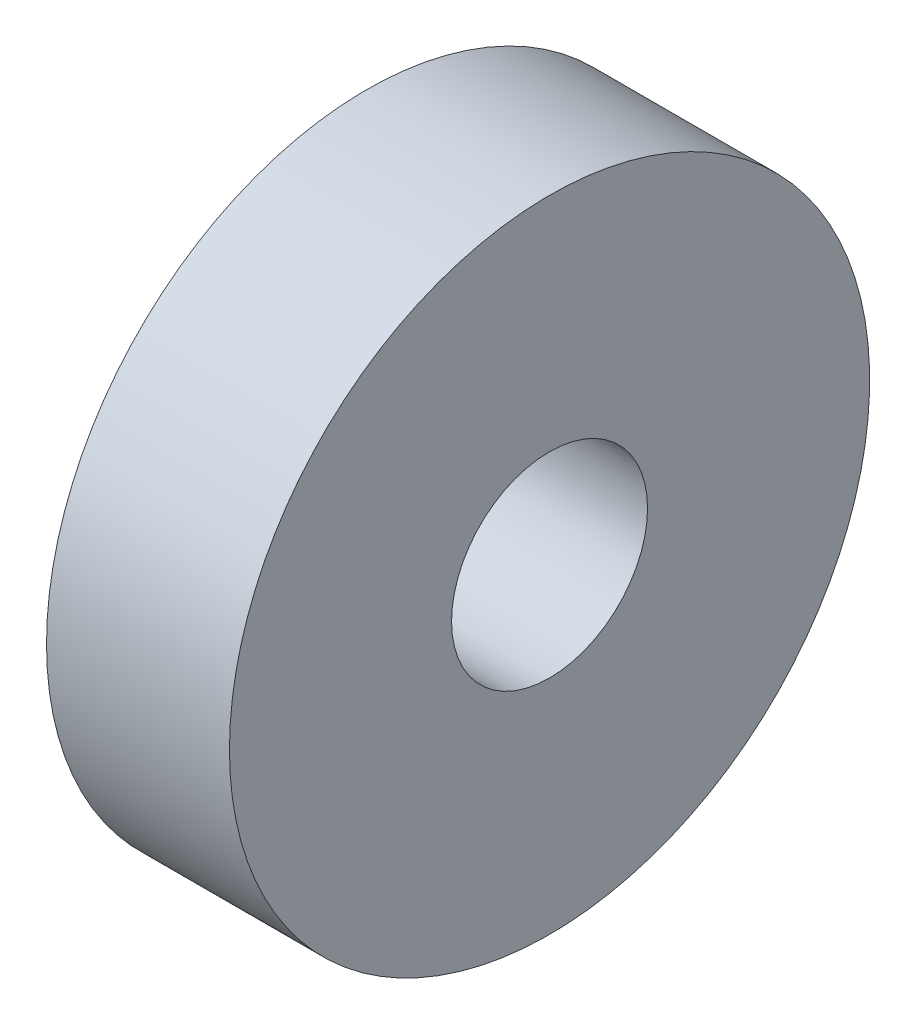
from build123d import *

# Parameters (mm, degrees)
SKETCH3_R           = 165.1
BOSS_EXTRUDE3_DEPTH = 88.9
CAVITY1_OUTLINE_R   = 152.4
CAVITY1_OUTLINE_R_2 = 50.8
CAVITY1_DEPTH       = 82.55
CAVITY1_2_OUTLINE_R = 50.8
CAVITY1_2_DEPTH     = 19.05
SKETCH4_R           = 47.625
CUT_EXTRUDE1_DEPTH  = 244.710981492
SKETCH5_R           = 165.1
SKETCH5_R_2         = 155.575
CUT_EXTRUDE2_DEPTH  = 250.838407776


# Read off the part's stored shape, not the designer's step: Cavity1
with BuildPart() as part:
    # Sketch3 → Boss-Extrude3 (new body)
    with BuildSketch(Plane(origin=(0, 0, 0), x_dir=(0, 0, -1), z_dir=(1, 0, 0))):
        Circle(SKETCH3_R)
    extrude(amount=BOSS_EXTRUDE3_DEPTH)

    # Cavity1 outline → Cavity1 (cut)
    with BuildSketch(Plane.YZ):
        Circle(CAVITY1_OUTLINE_R)
        with BuildLine():
            ThreePointArc((-80.874334871, -117.782034216), (-101.027881362, -101.027881362), (-117.782034216, -80.874334871))
            Line((-117.782034216, -80.874334871), (-94.778746917, -76.818234675))
            Line((-94.778746917, -76.818234675), (-76.818234675, -94.778746917))
            Line((-76.818234675, -94.778746917), (-80.874334871, -117.782034216))
        make_face(mode=Mode.SUBTRACT)
        with BuildLine():
            ThreePointArc((-29.644909568, -139.765678769), (-54.675895399, -131.999288208), (-77.867142651, -119.791375818))
            Line((-77.867142651, -119.791375818), (-58.16707868, -107.241050926))
            Line((-58.16707868, -107.241050926), (-34.700538554, -116.961210108))
            Line((-34.700538554, -116.961210108), (-29.644909568, -139.765678769))
        make_face(mode=Mode.SUBTRACT)
        Polygon((-27.135112552, -136.417422958), (-32.318310369, -113.037528491), (-19.758046068, -99.330405283), (-13.399363914, -116.800740918), align=None, mode=Mode.SUBTRACT)
        Polygon((-77.274262751, -115.64910694), (-73.115814864, -92.065377038), (-56.266154796, -84.208251511), (-57.077106506, -102.782099343), align=None, mode=Mode.SUBTRACT)
        Polygon((-54.018741267, -105.522753308), (-53.132050408, -85.214193765), (-33.571867462, -72.752982915), (-27.705232431, -75.18302271), (-22.685501123, -97.825567407), (-36.418836172, -112.812872694), align=None, mode=Mode.SUBTRACT)
        Polygon((-19.446749666, -97.765412591), (-22.958048426, -81.926967419), (-14.449239382, -72.641231776), (-10.141622048, -84.476313131), align=None, mode=Mode.SUBTRACT)
        with BuildLine():
            ThreePointArc((-119.791375818, -77.867142651), (-131.999288208, -54.675895399), (-139.765678769, -29.644909568))
            Line((-139.765678769, -29.644909568), (-116.961210108, -34.700538554))
            Line((-116.961210108, -34.700538554), (-107.241050926, -58.16707868))
            Line((-107.241050926, -58.16707868), (-119.791375818, -77.867142651))
        make_face(mode=Mode.SUBTRACT)
        Polygon((-115.64910694, -77.274262751), (-102.782099343, -57.077106506), (-84.208251511, -56.266154796), (-92.065377038, -73.115814864), align=None, mode=Mode.SUBTRACT)
        Polygon((-112.812872694, -36.418836172), (-97.825567407, -22.685501123), (-75.18302271, -27.705232431), (-72.752982915, -33.571867462), (-85.214193765, -53.132050408), (-105.522753308, -54.018741267), align=None, mode=Mode.SUBTRACT)
        Polygon((-136.417422958, -27.135112552), (-116.800740918, -13.399363914), (-99.330405283, -19.758046068), (-113.037528491, -32.318310369), align=None, mode=Mode.SUBTRACT)
        Polygon((-97.765412591, -19.446749666), (-84.476313131, -10.141622048), (-72.641231776, -14.449239382), (-81.926967419, -22.958048426), align=None, mode=Mode.SUBTRACT)
        Polygon((-90.288618857, -76.818234675), (-81.697674049, -58.39489408), (-58.857722433, -54.367594373), (-54.367594373, -58.857722433), (-58.39489408, -81.697674049), (-76.818234675, -90.288618857), align=None, mode=Mode.SUBTRACT)
        Polygon((-41.147952433, -61.582262732), (-41.6973225, -74.164905949), (-55.379657648, -82.88151477), (-52.562564142, -66.904983587), align=None, mode=Mode.SUBTRACT)
        Polygon((-82.88151477, -55.379657648), (-74.164905949, -41.6973225), (-61.582262732, -41.147952433), (-66.904983587, -52.562564142), align=None, mode=Mode.SUBTRACT)
        with BuildLine():
            Line((-58.006231883, -40.991819554), (-48.83234649, -40.591279067))
            ThreePointArc((-48.83234649, -40.591279067), (-44.901280605, -44.901280605), (-40.591279067, -48.83234649))
            Line((-40.591279067, -48.83234649), (-40.991819554, -58.006231883))
            Line((-40.991819554, -58.006231883), (-47.632402282, -61.102786463))
            Line((-47.632402282, -61.102786463), (-61.102786463, -47.632402282))
            Line((-61.102786463, -47.632402282), (-58.006231883, -40.991819554))
        make_face(mode=Mode.SUBTRACT)
        with BuildLine():
            Line((-37.903880189, -60.069527002), (-29.581595449, -56.188781894))
            ThreePointArc((-29.581595449, -56.188781894), (-24.300397955, -58.666350314), (-18.814121964, -60.648815444))
            Line((-18.814121964, -60.648815444), (-15.673479171, -69.2776606))
            Line((-15.673479171, -69.2776606), (-20.623577502, -74.67974499))
            Line((-20.623577502, -74.67974499), (-38.223482596, -67.389625603))
            Line((-38.223482596, -67.389625603), (-37.903880189, -60.069527002))
        make_face(mode=Mode.SUBTRACT)
        with BuildLine():
            Line((-69.2776606, -15.673479171), (-60.648815444, -18.814121964))
            ThreePointArc((-60.648815444, -18.814121964), (-58.666350314, -24.300397955), (-56.188781894, -29.581595449))
            Line((-56.188781894, -29.581595449), (-60.069527002, -37.903880189))
            Line((-60.069527002, -37.903880189), (-67.389625603, -38.223482596))
            Line((-67.389625603, -38.223482596), (-74.67974499, -20.623577502))
            Line((-74.67974499, -20.623577502), (-69.2776606, -15.673479171))
        make_face(mode=Mode.SUBTRACT)
        with BuildLine():
            ThreePointArc((26.097684485, -140.471265708), (0, -142.875), (-26.097684485, -140.471265708))
            Line((-26.097684485, -140.471265708), (-12.7, -121.337389315))
            Line((-12.7, -121.337389315), (12.7, -121.337389315))
            Line((12.7, -121.337389315), (26.097684485, -140.471265708))
        make_face(mode=Mode.SUBTRACT)
        Polygon((27.135112552, -136.417422958), (13.399363914, -116.800740918), (19.758046068, -99.330405283), (32.318310369, -113.037528491), align=None, mode=Mode.SUBTRACT)
        with BuildLine():
            ThreePointArc((77.867142651, -119.791375818), (54.675895399, -131.999288208), (29.644909568, -139.765678769))
            Line((29.644909568, -139.765678769), (34.700538554, -116.961210108))
            Line((34.700538554, -116.961210108), (58.16707868, -107.241050926))
            Line((58.16707868, -107.241050926), (77.867142651, -119.791375818))
        make_face(mode=Mode.SUBTRACT)
        Polygon((-9.525, -118.162389315), (-16.477553736, -99.060404918), (-3.175, -80.062389315), (3.175, -80.062389315), (16.477553736, -99.060404918), (9.525, -118.162389315), align=None, mode=Mode.SUBTRACT)
        Polygon((19.446749666, -97.765412591), (10.141622048, -84.476313131), (14.449239382, -72.641231776), (22.958048426, -81.926967419), align=None, mode=Mode.SUBTRACT)
        Polygon((77.274262751, -115.64910694), (57.077106506, -102.782099343), (56.266154796, -84.208251511), (73.115814864, -92.065377038), align=None, mode=Mode.SUBTRACT)
        Polygon((36.418836172, -112.812872694), (22.685501123, -97.825567407), (27.705232431, -75.18302271), (33.571867462, -72.752982915), (53.132050408, -85.214193765), (54.018741267, -105.522753308), align=None, mode=Mode.SUBTRACT)
        with BuildLine():
            ThreePointArc((117.782034216, -80.874334871), (101.027881362, -101.027881362), (80.874334871, -117.782034216))
            Line((80.874334871, -117.782034216), (76.818234675, -94.778746917))
            Line((76.818234675, -94.778746917), (94.778746917, -76.818234675))
            Line((94.778746917, -76.818234675), (117.782034216, -80.874334871))
        make_face(mode=Mode.SUBTRACT)
        with BuildLine():
            Line((-12.031006336, -70.002193495), (-5.827314658, -63.23205203))
            ThreePointArc((-5.827314658, -63.23205203), (0, -63.5), (5.827314658, -63.23205203))
            Line((5.827314658, -63.23205203), (12.031006336, -70.002193495))
            Line((12.031006336, -70.002193495), (9.525, -76.887389315))
            Line((9.525, -76.887389315), (-9.525, -76.887389315))
            Line((-9.525, -76.887389315), (-12.031006336, -70.002193495))
        make_face(mode=Mode.SUBTRACT)
        with BuildLine():
            Line((15.673479171, -69.2776606), (18.814121964, -60.648815444))
            ThreePointArc((18.814121964, -60.648815444), (24.300397955, -58.666350314), (29.581595449, -56.188781894))
            Line((29.581595449, -56.188781894), (37.903880189, -60.069527002))
            Line((37.903880189, -60.069527002), (38.223482596, -67.389625603))
            Line((38.223482596, -67.389625603), (20.623577502, -74.67974499))
            Line((20.623577502, -74.67974499), (15.673479171, -69.2776606))
        make_face(mode=Mode.SUBTRACT)
        Polygon((55.379657648, -82.88151477), (41.6973225, -74.164905949), (41.147952433, -61.582262732), (52.562564142, -66.904983587), align=None, mode=Mode.SUBTRACT)
        Polygon((76.818234675, -90.288618857), (58.39489408, -81.697674049), (54.367594373, -58.857722433), (58.857722433, -54.367594373), (81.697674049, -58.39489408), (90.288618857, -76.818234675), align=None, mode=Mode.SUBTRACT)
        with BuildLine():
            Line((40.991819554, -58.006231883), (40.591279067, -48.83234649))
            ThreePointArc((40.591279067, -48.83234649), (44.901280605, -44.901280605), (48.83234649, -40.591279067))
            Line((48.83234649, -40.591279067), (58.006231883, -40.991819554))
            Line((58.006231883, -40.991819554), (61.102786463, -47.632402282))
            Line((61.102786463, -47.632402282), (47.632402282, -61.102786463))
            Line((47.632402282, -61.102786463), (40.991819554, -58.006231883))
        make_face(mode=Mode.SUBTRACT)
        Polygon((82.88151477, -55.379657648), (66.904983587, -52.562564142), (61.582262732, -41.147952433), (74.164905949, -41.6973225), align=None, mode=Mode.SUBTRACT)
        with BuildLine():
            Line((60.069527002, -37.903880189), (56.188781894, -29.581595449))
            ThreePointArc((56.188781894, -29.581595449), (58.666350314, -24.300397955), (60.648815444, -18.814121964))
            Line((60.648815444, -18.814121964), (69.2776606, -15.673479171))
            Line((69.2776606, -15.673479171), (74.67974499, -20.623577502))
            Line((74.67974499, -20.623577502), (67.389625603, -38.223482596))
            Line((67.389625603, -38.223482596), (60.069527002, -37.903880189))
        make_face(mode=Mode.SUBTRACT)
        Polygon((115.64910694, -77.274262751), (92.065377038, -73.115814864), (84.208251511, -56.266154796), (102.782099343, -57.077106506), align=None, mode=Mode.SUBTRACT)
        Polygon((105.522753308, -54.018741267), (85.214193765, -53.132050408), (72.752982915, -33.571867462), (75.18302271, -27.705232431), (97.825567407, -22.685501123), (112.812872694, -36.418836172), align=None, mode=Mode.SUBTRACT)
        with BuildLine():
            ThreePointArc((139.765678769, -29.644909568), (131.999288208, -54.675895399), (119.791375818, -77.867142651))
            Line((119.791375818, -77.867142651), (107.241050926, -58.16707868))
            Line((107.241050926, -58.16707868), (116.961210108, -34.700538554))
            Line((116.961210108, -34.700538554), (139.765678769, -29.644909568))
        make_face(mode=Mode.SUBTRACT)
        Polygon((97.765412591, -19.446749666), (81.926967419, -22.958048426), (72.641231776, -14.449239382), (84.476313131, -10.141622048), align=None, mode=Mode.SUBTRACT)
        Polygon((136.417422958, -27.135112552), (113.037528491, -32.318310369), (99.330405283, -19.758046068), (116.800740918, -13.399363914), align=None, mode=Mode.SUBTRACT)
        with BuildLine():
            ThreePointArc((-140.471265708, -26.097684485), (-142.875, 0), (-140.471265708, 26.097684485))
            Line((-140.471265708, 26.097684485), (-121.337389315, 12.7))
            Line((-121.337389315, 12.7), (-121.337389315, -12.7))
            Line((-121.337389315, -12.7), (-140.471265708, -26.097684485))
        make_face(mode=Mode.SUBTRACT)
        Polygon((-136.417422958, 27.135112552), (-113.037528491, 32.318310369), (-99.330405283, 19.758046068), (-116.800740918, 13.399363914), align=None, mode=Mode.SUBTRACT)
        Polygon((-118.162389315, 9.525), (-99.060404918, 16.477553736), (-80.062389315, 3.175), (-80.062389315, -3.175), (-99.060404918, -16.477553736), (-118.162389315, -9.525), align=None, mode=Mode.SUBTRACT)
        Polygon((-97.765412591, 19.446749666), (-81.926967419, 22.958048426), (-72.641231776, 14.449239382), (-84.476313131, 10.141622048), align=None, mode=Mode.SUBTRACT)
        with BuildLine():
            ThreePointArc((-139.765678769, 29.644909568), (-131.999288208, 54.675895399), (-119.791375818, 77.867142651))
            Line((-119.791375818, 77.867142651), (-107.241050926, 58.16707868))
            Line((-107.241050926, 58.16707868), (-116.961210108, 34.700538554))
            Line((-116.961210108, 34.700538554), (-139.765678769, 29.644909568))
        make_face(mode=Mode.SUBTRACT)
        Polygon((-105.522753308, 54.018741267), (-85.214193765, 53.132050408), (-72.752982915, 33.571867462), (-75.18302271, 27.705232431), (-97.825567407, 22.685501123), (-112.812872694, 36.418836172), align=None, mode=Mode.SUBTRACT)
        Polygon((-115.64910694, 77.274262751), (-92.065377038, 73.115814864), (-84.208251511, 56.266154796), (-102.782099343, 57.077106506), align=None, mode=Mode.SUBTRACT)
        with BuildLine():
            Line((-70.002193495, 12.031006336), (-63.23205203, 5.827314658))
            ThreePointArc((-63.23205203, 5.827314658), (-63.5, 0), (-63.23205203, -5.827314658))
            Line((-63.23205203, -5.827314658), (-70.002193495, -12.031006336))
            Line((-70.002193495, -12.031006336), (-76.887389315, -9.525))
            Line((-76.887389315, -9.525), (-76.887389315, 9.525))
            Line((-76.887389315, 9.525), (-70.002193495, 12.031006336))
        make_face(mode=Mode.SUBTRACT)
        with BuildLine():
            Line((-60.069527002, 37.903880189), (-56.188781894, 29.581595449))
            ThreePointArc((-56.188781894, 29.581595449), (-58.666350314, 24.300397955), (-60.648815444, 18.814121964))
            Line((-60.648815444, 18.814121964), (-69.2776606, 15.673479171))
            Line((-69.2776606, 15.673479171), (-74.67974499, 20.623577502))
            Line((-74.67974499, 20.623577502), (-67.389625603, 38.223482596))
            Line((-67.389625603, 38.223482596), (-60.069527002, 37.903880189))
        make_face(mode=Mode.SUBTRACT)
        Polygon((-61.582262732, 41.147952433), (-74.164905949, 41.6973225), (-82.88151477, 55.379657648), (-66.904983587, 52.562564142), align=None, mode=Mode.SUBTRACT)
        with BuildLine():
            Line((-40.991819554, 58.006231883), (-40.591279067, 48.83234649))
            ThreePointArc((-40.591279067, 48.83234649), (-44.901280605, 44.901280605), (-48.83234649, 40.591279067))
            Line((-48.83234649, 40.591279067), (-58.006231883, 40.991819554))
            Line((-58.006231883, 40.991819554), (-61.102786463, 47.632402282))
            Line((-61.102786463, 47.632402282), (-47.632402282, 61.102786463))
            Line((-47.632402282, 61.102786463), (-40.991819554, 58.006231883))
        make_face(mode=Mode.SUBTRACT)
        Polygon((-76.818234675, 90.288618857), (-58.39489408, 81.697674049), (-54.367594373, 58.857722433), (-58.857722433, 54.367594373), (-81.697674049, 58.39489408), (-90.288618857, 76.818234675), align=None, mode=Mode.SUBTRACT)
        Polygon((-41.147952433, 61.582262732), (-52.562564142, 66.904983587), (-55.379657648, 82.88151477), (-41.6973225, 74.164905949), align=None, mode=Mode.SUBTRACT)
        with BuildLine():
            Line((-15.673479171, 69.2776606), (-18.814121964, 60.648815444))
            ThreePointArc((-18.814121964, 60.648815444), (-24.300397955, 58.666350314), (-29.581595449, 56.188781894))
            Line((-29.581595449, 56.188781894), (-37.903880189, 60.069527002))
            Line((-37.903880189, 60.069527002), (-38.223482596, 67.389625603))
            Line((-38.223482596, 67.389625603), (-20.623577502, 74.67974499))
            Line((-20.623577502, 74.67974499), (-15.673479171, 69.2776606))
        make_face(mode=Mode.SUBTRACT)
        with BuildLine():
            ThreePointArc((-117.782034216, 80.874334871), (-101.027881362, 101.027881362), (-80.874334871, 117.782034216))
            Line((-80.874334871, 117.782034216), (-76.818234675, 94.778746917))
            Line((-76.818234675, 94.778746917), (-94.778746917, 76.818234675))
            Line((-94.778746917, 76.818234675), (-117.782034216, 80.874334871))
        make_face(mode=Mode.SUBTRACT)
        Polygon((-36.418836172, 112.812872694), (-22.685501123, 97.825567407), (-27.705232431, 75.18302271), (-33.571867462, 72.752982915), (-53.132050408, 85.214193765), (-54.018741267, 105.522753308), align=None, mode=Mode.SUBTRACT)
        Polygon((-77.274262751, 115.64910694), (-57.077106506, 102.782099343), (-56.266154796, 84.208251511), (-73.115814864, 92.065377038), align=None, mode=Mode.SUBTRACT)
        Polygon((-19.446749666, 97.765412591), (-10.141622048, 84.476313131), (-14.449239382, 72.641231776), (-22.958048426, 81.926967419), align=None, mode=Mode.SUBTRACT)
        with BuildLine():
            ThreePointArc((-77.867142651, 119.791375818), (-54.675895399, 131.999288208), (-29.644909568, 139.765678769))
            Line((-29.644909568, 139.765678769), (-34.700538554, 116.961210108))
            Line((-34.700538554, 116.961210108), (-58.16707868, 107.241050926))
            Line((-58.16707868, 107.241050926), (-77.867142651, 119.791375818))
        make_face(mode=Mode.SUBTRACT)
        Polygon((-27.135112552, 136.417422958), (-13.399363914, 116.800740918), (-19.758046068, 99.330405283), (-32.318310369, 113.037528491), align=None, mode=Mode.SUBTRACT)
        Circle(CAVITY1_OUTLINE_R_2, mode=Mode.SUBTRACT)
        with BuildLine():
            Line((70.002193495, -12.031006336), (63.23205203, -5.827314658))
            ThreePointArc((63.23205203, -5.827314658), (63.5, 0), (63.23205203, 5.827314658))
            Line((63.23205203, 5.827314658), (70.002193495, 12.031006336))
            Line((70.002193495, 12.031006336), (76.887389315, 9.525))
            Line((76.887389315, 9.525), (76.887389315, -9.525))
            Line((76.887389315, -9.525), (70.002193495, -12.031006336))
        make_face(mode=Mode.SUBTRACT)
        with BuildLine():
            Line((56.188781894, 29.581595449), (60.069527002, 37.903880189))
            Line((60.069527002, 37.903880189), (67.389625603, 38.223482596))
            Line((67.389625603, 38.223482596), (74.67974499, 20.623577502))
            Line((74.67974499, 20.623577502), (69.2776606, 15.673479171))
            Line((69.2776606, 15.673479171), (60.648815444, 18.814121964))
            ThreePointArc((60.648815444, 18.814121964), (58.666350314, 24.300397955), (56.188781894, 29.581595449))
        make_face(mode=Mode.SUBTRACT)
        with BuildLine():
            Line((12.031006336, 70.002193495), (5.827314658, 63.23205203))
            ThreePointArc((5.827314658, 63.23205203), (0, 63.5), (-5.827314658, 63.23205203))
            Line((-5.827314658, 63.23205203), (-12.031006336, 70.002193495))
            Line((-12.031006336, 70.002193495), (-9.525, 76.887389315))
            Line((-9.525, 76.887389315), (9.525, 76.887389315))
            Line((9.525, 76.887389315), (12.031006336, 70.002193495))
        make_face(mode=Mode.SUBTRACT)
        with BuildLine():
            Line((37.903880189, 60.069527002), (29.581595449, 56.188781894))
            ThreePointArc((29.581595449, 56.188781894), (24.300397955, 58.666350314), (18.814121964, 60.648815444))
            Line((18.814121964, 60.648815444), (15.673479171, 69.2776606))
            Line((15.673479171, 69.2776606), (20.623577502, 74.67974499))
            Line((20.623577502, 74.67974499), (38.223482596, 67.389625603))
            Line((38.223482596, 67.389625603), (37.903880189, 60.069527002))
        make_face(mode=Mode.SUBTRACT)
        with BuildLine():
            Line((61.102786463, 47.632402282), (58.006231883, 40.991819554))
            Line((58.006231883, 40.991819554), (48.83234649, 40.591279067))
            ThreePointArc((48.83234649, 40.591279067), (44.901280605, 44.901280605), (40.591279067, 48.83234649))
            Line((40.591279067, 48.83234649), (40.991819554, 58.006231883))
            Line((40.991819554, 58.006231883), (47.632402282, 61.102786463))
            Line((47.632402282, 61.102786463), (61.102786463, 47.632402282))
        make_face(mode=Mode.SUBTRACT)
        Polygon((82.88151477, 55.379657648), (74.164905949, 41.6973225), (61.582262732, 41.147952433), (66.904983587, 52.562564142), align=None, mode=Mode.SUBTRACT)
        Polygon((41.147952433, 61.582262732), (41.6973225, 74.164905949), (55.379657648, 82.88151477), (52.562564142, 66.904983587), align=None, mode=Mode.SUBTRACT)
        Polygon((90.288618857, 76.818234675), (81.697674049, 58.39489408), (58.857722433, 54.367594373), (54.367594373, 58.857722433), (58.39489408, 81.697674049), (76.818234675, 90.288618857), align=None, mode=Mode.SUBTRACT)
        Polygon((97.765412591, 19.446749666), (84.476313131, 10.141622048), (72.641231776, 14.449239382), (81.926967419, 22.958048426), align=None, mode=Mode.SUBTRACT)
        Polygon((99.060404918, -16.477553736), (80.062389315, -3.175), (80.062389315, 3.175), (99.060404918, 16.477553736), (118.162389315, 9.525), (118.162389315, -9.525), align=None, mode=Mode.SUBTRACT)
        with BuildLine():
            ThreePointArc((140.471265708, 26.097684485), (142.875, 0), (140.471265708, -26.097684485))
            Line((140.471265708, -26.097684485), (121.337389315, -12.7))
            Line((121.337389315, -12.7), (121.337389315, 12.7))
            Line((121.337389315, 12.7), (140.471265708, 26.097684485))
        make_face(mode=Mode.SUBTRACT)
        Polygon((113.037528491, 32.318310369), (136.417422958, 27.135112552), (116.800740918, 13.399363914), (99.330405283, 19.758046068), align=None, mode=Mode.SUBTRACT)
        Polygon((112.812872694, 36.418836172), (97.825567407, 22.685501123), (75.18302271, 27.705232431), (72.752982915, 33.571867462), (85.214193765, 53.132050408), (105.522753308, 54.018741267), align=None, mode=Mode.SUBTRACT)
        Polygon((115.64910694, 77.274262751), (102.782099343, 57.077106506), (84.208251511, 56.266154796), (92.065377038, 73.115814864), align=None, mode=Mode.SUBTRACT)
        with BuildLine():
            ThreePointArc((119.791375818, 77.867142651), (131.999288208, 54.675895399), (139.765678769, 29.644909568))
            Line((139.765678769, 29.644909568), (116.961210108, 34.700538554))
            Line((116.961210108, 34.700538554), (107.241050926, 58.16707868))
            Line((107.241050926, 58.16707868), (119.791375818, 77.867142651))
        make_face(mode=Mode.SUBTRACT)
        Polygon((14.449239382, 72.641231776), (10.141622048, 84.476313131), (19.446749666, 97.765412591), (22.958048426, 81.926967419), align=None, mode=Mode.SUBTRACT)
        Polygon((9.525, 118.162389315), (16.477553736, 99.060404918), (3.175, 80.062389315), (-3.175, 80.062389315), (-16.477553736, 99.060404918), (-9.525, 118.162389315), align=None, mode=Mode.SUBTRACT)
        Polygon((54.018741267, 105.522753308), (53.132050408, 85.214193765), (33.571867462, 72.752982915), (27.705232431, 75.18302271), (22.685501123, 97.825567407), (36.418836172, 112.812872694), align=None, mode=Mode.SUBTRACT)
        Polygon((77.274262751, 115.64910694), (73.115814864, 92.065377038), (56.266154796, 84.208251511), (57.077106506, 102.782099343), align=None, mode=Mode.SUBTRACT)
        with BuildLine():
            ThreePointArc((-26.097684485, 140.471265708), (0, 142.875), (26.097684485, 140.471265708))
            Line((26.097684485, 140.471265708), (12.7, 121.337389315))
            Line((12.7, 121.337389315), (-12.7, 121.337389315))
            Line((-12.7, 121.337389315), (-26.097684485, 140.471265708))
        make_face(mode=Mode.SUBTRACT)
        Polygon((27.135112552, 136.417422958), (32.318310369, 113.037528491), (19.758046068, 99.330405283), (13.399363914, 116.800740918), align=None, mode=Mode.SUBTRACT)
        with BuildLine():
            ThreePointArc((29.644909568, 139.765678769), (54.675895399, 131.999288208), (77.867142651, 119.791375818))
            Line((77.867142651, 119.791375818), (58.16707868, 107.241050926))
            Line((58.16707868, 107.241050926), (34.700538554, 116.961210108))
            Line((34.700538554, 116.961210108), (29.644909568, 139.765678769))
        make_face(mode=Mode.SUBTRACT)
        with BuildLine():
            ThreePointArc((80.874334871, 117.782034216), (101.027881362, 101.027881362), (117.782034216, 80.874334871))
            Line((117.782034216, 80.874334871), (94.778746917, 76.818234675))
            Line((94.778746917, 76.818234675), (76.818234675, 94.778746917))
            Line((76.818234675, 94.778746917), (80.874334871, 117.782034216))
        make_face(mode=Mode.SUBTRACT)
    extrude(amount=CAVITY1_DEPTH, mode=Mode.SUBTRACT)

    # Cavity1 2 outline → Cavity1 2 (cut)
    with BuildSketch(Plane.YZ):
        Circle(CAVITY1_2_OUTLINE_R)
        with BuildLine():
            Line((121.337389315, -12.7), (140.471265708, -26.097684485))
            ThreePointArc((140.471265708, -26.097684485), (142.875, 0), (140.471265708, 26.097684485))
            Line((140.471265708, 26.097684485), (121.337389315, 12.7))
            Line((121.337389315, 12.7), (121.337389315, -12.7))
        make_face()
        with BuildLine():
            Line((116.961210108, 34.700538554), (139.765678769, 29.644909568))
            ThreePointArc((139.765678769, 29.644909568), (131.999288208, 54.675895399), (119.791375818, 77.867142651))
            Line((119.791375818, 77.867142651), (107.241050926, 58.16707868))
            Line((107.241050926, 58.16707868), (116.961210108, 34.700538554))
        make_face()
        with BuildLine():
            Line((94.778746917, 76.818234675), (117.782034216, 80.874334871))
            ThreePointArc((117.782034216, 80.874334871), (101.027881362, 101.027881362), (80.874334871, 117.782034216))
            Line((80.874334871, 117.782034216), (76.818234675, 94.778746917))
            Line((76.818234675, 94.778746917), (94.778746917, 76.818234675))
        make_face()
        with BuildLine():
            Line((-94.778746917, -76.818234675), (-117.782034216, -80.874334871))
            ThreePointArc((-117.782034216, -80.874334871), (-101.027881362, -101.027881362), (-80.874334871, -117.782034216))
            Line((-80.874334871, -117.782034216), (-76.818234675, -94.778746917))
            Line((-76.818234675, -94.778746917), (-94.778746917, -76.818234675))
        make_face()
        with BuildLine():
            Line((76.818234675, -94.778746917), (80.874334871, -117.782034216))
            ThreePointArc((80.874334871, -117.782034216), (101.027881362, -101.027881362), (117.782034216, -80.874334871))
            Line((117.782034216, -80.874334871), (94.778746917, -76.818234675))
            Line((94.778746917, -76.818234675), (76.818234675, -94.778746917))
        make_face()
        with BuildLine():
            Line((107.241050926, -58.16707868), (119.791375818, -77.867142651))
            ThreePointArc((119.791375818, -77.867142651), (131.999288208, -54.675895399), (139.765678769, -29.644909568))
            Line((139.765678769, -29.644909568), (116.961210108, -34.700538554))
            Line((116.961210108, -34.700538554), (107.241050926, -58.16707868))
        make_face()
        with BuildLine():
            Line((-12.7, -121.337389315), (-26.097684485, -140.471265708))
            ThreePointArc((-26.097684485, -140.471265708), (0, -142.875), (26.097684485, -140.471265708))
            Line((26.097684485, -140.471265708), (12.7, -121.337389315))
            Line((12.7, -121.337389315), (-12.7, -121.337389315))
        make_face()
        with BuildLine():
            Line((-58.16707868, -107.241050926), (-77.867142651, -119.791375818))
            ThreePointArc((-77.867142651, -119.791375818), (-54.675895399, -131.999288208), (-29.644909568, -139.765678769))
            Line((-29.644909568, -139.765678769), (-34.700538554, -116.961210108))
            Line((-34.700538554, -116.961210108), (-58.16707868, -107.241050926))
        make_face()
        with BuildLine():
            Line((34.700538554, -116.961210108), (29.644909568, -139.765678769))
            ThreePointArc((29.644909568, -139.765678769), (54.675895399, -131.999288208), (77.867142651, -119.791375818))
            Line((77.867142651, -119.791375818), (58.16707868, -107.241050926))
            Line((58.16707868, -107.241050926), (34.700538554, -116.961210108))
        make_face()
        with BuildLine():
            Line((-34.700538554, 116.961210108), (-29.644909568, 139.765678769))
            ThreePointArc((-29.644909568, 139.765678769), (-54.675895399, 131.999288208), (-77.867142651, 119.791375818))
            Line((-77.867142651, 119.791375818), (-58.16707868, 107.241050926))
            Line((-58.16707868, 107.241050926), (-34.700538554, 116.961210108))
        make_face()
        with BuildLine():
            Line((58.16707868, 107.241050926), (77.867142651, 119.791375818))
            ThreePointArc((77.867142651, 119.791375818), (54.675895399, 131.999288208), (29.644909568, 139.765678769))
            Line((29.644909568, 139.765678769), (34.700538554, 116.961210108))
            Line((34.700538554, 116.961210108), (58.16707868, 107.241050926))
        make_face()
        with BuildLine():
            Line((12.7, 121.337389315), (26.097684485, 140.471265708))
            ThreePointArc((26.097684485, 140.471265708), (0, 142.875), (-26.097684485, 140.471265708))
            Line((-26.097684485, 140.471265708), (-12.7, 121.337389315))
            Line((-12.7, 121.337389315), (12.7, 121.337389315))
        make_face()
        with BuildLine():
            Line((-121.337389315, 12.7), (-140.471265708, 26.097684485))
            ThreePointArc((-140.471265708, 26.097684485), (-142.875, 0), (-140.471265708, -26.097684485))
            Line((-140.471265708, -26.097684485), (-121.337389315, -12.7))
            Line((-121.337389315, -12.7), (-121.337389315, 12.7))
        make_face()
        with BuildLine():
            Line((-116.961210108, -34.700538554), (-139.765678769, -29.644909568))
            ThreePointArc((-139.765678769, -29.644909568), (-131.999288208, -54.675895399), (-119.791375818, -77.867142651))
            Line((-119.791375818, -77.867142651), (-107.241050926, -58.16707868))
            Line((-107.241050926, -58.16707868), (-116.961210108, -34.700538554))
        make_face()
        with BuildLine():
            Line((-76.818234675, 94.778746917), (-80.874334871, 117.782034216))
            ThreePointArc((-80.874334871, 117.782034216), (-101.027881362, 101.027881362), (-117.782034216, 80.874334871))
            Line((-117.782034216, 80.874334871), (-94.778746917, 76.818234675))
            Line((-94.778746917, 76.818234675), (-76.818234675, 94.778746917))
        make_face()
        with BuildLine():
            Line((-107.241050926, 58.16707868), (-119.791375818, 77.867142651))
            ThreePointArc((-119.791375818, 77.867142651), (-131.999288208, 54.675895399), (-139.765678769, 29.644909568))
            Line((-139.765678769, 29.644909568), (-116.961210108, 34.700538554))
            Line((-116.961210108, 34.700538554), (-107.241050926, 58.16707868))
        make_face()
        Polygon((84.208251511, 56.266154796), (102.782099343, 57.077106506), (115.64910694, 77.274262751), (92.065377038, 73.115814864), align=None)
        Polygon((61.582262732, 41.147952433), (74.164905949, 41.6973225), (82.88151477, 55.379657648), (66.904983587, 52.562564142), align=None)
        with BuildLine():
            Line((48.83234649, 40.591279067), (58.006231883, 40.991819554))
            Line((58.006231883, 40.991819554), (61.102786463, 47.632402282))
            Line((61.102786463, 47.632402282), (47.632402282, 61.102786463))
            Line((47.632402282, 61.102786463), (40.991819554, 58.006231883))
            Line((40.991819554, 58.006231883), (40.591279067, 48.83234649))
            ThreePointArc((40.591279067, 48.83234649), (44.901280605, 44.901280605), (48.83234649, 40.591279067))
        make_face()
        with BuildLine():
            Line((67.389625603, 38.223482596), (60.069527002, 37.903880189))
            Line((60.069527002, 37.903880189), (56.188781894, 29.581595449))
            ThreePointArc((56.188781894, 29.581595449), (58.666350314, 24.300397955), (60.648815444, 18.814121964))
            Line((60.648815444, 18.814121964), (69.2776606, 15.673479171))
            Line((69.2776606, 15.673479171), (74.67974499, 20.623577502))
            Line((74.67974499, 20.623577502), (67.389625603, 38.223482596))
        make_face()
        Polygon((55.379657648, 82.88151477), (41.6973225, 74.164905949), (41.147952433, 61.582262732), (52.562564142, 66.904983587), align=None)
        with BuildLine():
            ThreePointArc((-40.591279067, -48.83234649), (-44.901280605, -44.901280605), (-48.83234649, -40.591279067))
            Line((-48.83234649, -40.591279067), (-58.006231883, -40.991819554))
            Line((-58.006231883, -40.991819554), (-61.102786463, -47.632402282))
            Line((-61.102786463, -47.632402282), (-47.632402282, -61.102786463))
            Line((-47.632402282, -61.102786463), (-40.991819554, -58.006231883))
            Line((-40.991819554, -58.006231883), (-40.591279067, -48.83234649))
        make_face()
        with BuildLine():
            ThreePointArc((5.827314658, -63.23205203), (0, -63.5), (-5.827314658, -63.23205203))
            Line((-5.827314658, -63.23205203), (-12.031006336, -70.002193495))
            Line((-12.031006336, -70.002193495), (-9.525, -76.887389315))
            Line((-9.525, -76.887389315), (9.525, -76.887389315))
            Line((9.525, -76.887389315), (12.031006336, -70.002193495))
            Line((12.031006336, -70.002193495), (5.827314658, -63.23205203))
        make_face()
        with BuildLine():
            ThreePointArc((48.83234649, -40.591279067), (44.901280605, -44.901280605), (40.591279067, -48.83234649))
            Line((40.591279067, -48.83234649), (40.991819554, -58.006231883))
            Line((40.991819554, -58.006231883), (47.632402282, -61.102786463))
            Line((47.632402282, -61.102786463), (61.102786463, -47.632402282))
            Line((61.102786463, -47.632402282), (58.006231883, -40.991819554))
            Line((58.006231883, -40.991819554), (48.83234649, -40.591279067))
        make_face()
        with BuildLine():
            ThreePointArc((63.23205203, 5.827314658), (63.5, 0), (63.23205203, -5.827314658))
            Line((63.23205203, -5.827314658), (70.002193495, -12.031006336))
            Line((70.002193495, -12.031006336), (76.887389315, -9.525))
            Line((76.887389315, -9.525), (76.887389315, 9.525))
            Line((76.887389315, 9.525), (70.002193495, 12.031006336))
            Line((70.002193495, 12.031006336), (63.23205203, 5.827314658))
        make_face()
        with BuildLine():
            ThreePointArc((60.648815444, -18.814121964), (58.666350314, -24.300397955), (56.188781894, -29.581595449))
            Line((56.188781894, -29.581595449), (60.069527002, -37.903880189))
            Line((60.069527002, -37.903880189), (67.389625603, -38.223482596))
            Line((67.389625603, -38.223482596), (74.67974499, -20.623577502))
            Line((74.67974499, -20.623577502), (69.2776606, -15.673479171))
            Line((69.2776606, -15.673479171), (60.648815444, -18.814121964))
        make_face()
        with BuildLine():
            ThreePointArc((-18.814121964, -60.648815444), (-24.300397955, -58.666350314), (-29.581595449, -56.188781894))
            Line((-29.581595449, -56.188781894), (-37.903880189, -60.069527002))
            Line((-37.903880189, -60.069527002), (-38.223482596, -67.389625603))
            Line((-38.223482596, -67.389625603), (-20.623577502, -74.67974499))
            Line((-20.623577502, -74.67974499), (-15.673479171, -69.2776606))
            Line((-15.673479171, -69.2776606), (-18.814121964, -60.648815444))
        make_face()
        with BuildLine():
            ThreePointArc((29.581595449, -56.188781894), (24.300397955, -58.666350314), (18.814121964, -60.648815444))
            Line((18.814121964, -60.648815444), (15.673479171, -69.2776606))
            Line((15.673479171, -69.2776606), (20.623577502, -74.67974499))
            Line((20.623577502, -74.67974499), (38.223482596, -67.389625603))
            Line((38.223482596, -67.389625603), (37.903880189, -60.069527002))
            Line((37.903880189, -60.069527002), (29.581595449, -56.188781894))
        make_face()
        with BuildLine():
            ThreePointArc((-29.581595449, 56.188781894), (-24.300397955, 58.666350314), (-18.814121964, 60.648815444))
            Line((-18.814121964, 60.648815444), (-15.673479171, 69.2776606))
            Line((-15.673479171, 69.2776606), (-20.623577502, 74.67974499))
            Line((-20.623577502, 74.67974499), (-38.223482596, 67.389625603))
            Line((-38.223482596, 67.389625603), (-37.903880189, 60.069527002))
            Line((-37.903880189, 60.069527002), (-29.581595449, 56.188781894))
        make_face()
        with BuildLine():
            ThreePointArc((-48.83234649, 40.591279067), (-44.901280605, 44.901280605), (-40.591279067, 48.83234649))
            Line((-40.591279067, 48.83234649), (-40.991819554, 58.006231883))
            Line((-40.991819554, 58.006231883), (-47.632402282, 61.102786463))
            Line((-47.632402282, 61.102786463), (-61.102786463, 47.632402282))
            Line((-61.102786463, 47.632402282), (-58.006231883, 40.991819554))
            Line((-58.006231883, 40.991819554), (-48.83234649, 40.591279067))
        make_face()
        with BuildLine():
            ThreePointArc((18.814121964, 60.648815444), (24.300397955, 58.666350314), (29.581595449, 56.188781894))
            Line((29.581595449, 56.188781894), (37.903880189, 60.069527002))
            Line((37.903880189, 60.069527002), (38.223482596, 67.389625603))
            Line((38.223482596, 67.389625603), (20.623577502, 74.67974499))
            Line((20.623577502, 74.67974499), (15.673479171, 69.2776606))
            Line((15.673479171, 69.2776606), (18.814121964, 60.648815444))
        make_face()
        with BuildLine():
            ThreePointArc((-5.827314658, 63.23205203), (0, 63.5), (5.827314658, 63.23205203))
            Line((5.827314658, 63.23205203), (12.031006336, 70.002193495))
            Line((12.031006336, 70.002193495), (9.525, 76.887389315))
            Line((9.525, 76.887389315), (-9.525, 76.887389315))
            Line((-9.525, 76.887389315), (-12.031006336, 70.002193495))
            Line((-12.031006336, 70.002193495), (-5.827314658, 63.23205203))
        make_face()
        with BuildLine():
            ThreePointArc((-56.188781894, -29.581595449), (-58.666350314, -24.300397955), (-60.648815444, -18.814121964))
            Line((-60.648815444, -18.814121964), (-69.2776606, -15.673479171))
            Line((-69.2776606, -15.673479171), (-74.67974499, -20.623577502))
            Line((-74.67974499, -20.623577502), (-67.389625603, -38.223482596))
            Line((-67.389625603, -38.223482596), (-60.069527002, -37.903880189))
            Line((-60.069527002, -37.903880189), (-56.188781894, -29.581595449))
        make_face()
        with BuildLine():
            ThreePointArc((-63.23205203, -5.827314658), (-63.5, 0), (-63.23205203, 5.827314658))
            Line((-63.23205203, 5.827314658), (-70.002193495, 12.031006336))
            Line((-70.002193495, 12.031006336), (-76.887389315, 9.525))
            Line((-76.887389315, 9.525), (-76.887389315, -9.525))
            Line((-76.887389315, -9.525), (-70.002193495, -12.031006336))
            Line((-70.002193495, -12.031006336), (-63.23205203, -5.827314658))
        make_face()
        with BuildLine():
            ThreePointArc((-60.648815444, 18.814121964), (-58.666350314, 24.300397955), (-56.188781894, 29.581595449))
            Line((-56.188781894, 29.581595449), (-60.069527002, 37.903880189))
            Line((-60.069527002, 37.903880189), (-67.389625603, 38.223482596))
            Line((-67.389625603, 38.223482596), (-74.67974499, 20.623577502))
            Line((-74.67974499, 20.623577502), (-69.2776606, 15.673479171))
            Line((-69.2776606, 15.673479171), (-60.648815444, 18.814121964))
        make_face()
        Polygon((56.266154796, 84.208251511), (73.115814864, 92.065377038), (77.274262751, 115.64910694), (57.077106506, 102.782099343), align=None)
        Polygon((58.857722433, 54.367594373), (81.697674049, 58.39489408), (90.288618857, 76.818234675), (76.818234675, 90.288618857), (58.39489408, 81.697674049), (54.367594373, 58.857722433), align=None)
        Polygon((72.641231776, -14.449239382), (81.926967419, -22.958048426), (97.765412591, -19.446749666), (84.476313131, -10.141622048), align=None)
        Polygon((-72.641231776, 14.449239382), (-81.926967419, 22.958048426), (-97.765412591, 19.446749666), (-84.476313131, 10.141622048), align=None)
        Polygon((-99.330405283, 19.758046068), (-113.037528491, 32.318310369), (-136.417422958, 27.135112552), (-116.800740918, 13.399363914), align=None)
        Polygon((72.641231776, 14.449239382), (84.476313131, 10.141622048), (97.765412591, 19.446749666), (81.926967419, 22.958048426), align=None)
        Polygon((75.18302271, 27.705232431), (97.825567407, 22.685501123), (112.812872694, 36.418836172), (105.522753308, 54.018741267), (85.214193765, 53.132050408), (72.752982915, 33.571867462), align=None)
        Polygon((116.800740918, 13.399363914), (136.417422958, 27.135112552), (113.037528491, 32.318310369), (99.330405283, 19.758046068), align=None)
        Polygon((19.758046068, -99.330405283), (13.399363914, -116.800740918), (27.135112552, -136.417422958), (32.318310369, -113.037528491), align=None)
        Polygon((41.147952433, -61.582262732), (41.6973225, -74.164905949), (55.379657648, -82.88151477), (52.562564142, -66.904983587), align=None)
        Polygon((56.266154796, -84.208251511), (57.077106506, -102.782099343), (77.274262751, -115.64910694), (73.115814864, -92.065377038), align=None)
        Polygon((99.330405283, -19.758046068), (113.037528491, -32.318310369), (136.417422958, -27.135112552), (116.800740918, -13.399363914), align=None)
        Polygon((84.208251511, -56.266154796), (92.065377038, -73.115814864), (115.64910694, -77.274262751), (102.782099343, -57.077106506), align=None)
        Polygon((61.582262732, -41.147952433), (66.904983587, -52.562564142), (82.88151477, -55.379657648), (74.164905949, -41.6973225), align=None)
        Polygon((-55.379657648, -82.88151477), (-41.6973225, -74.164905949), (-41.147952433, -61.582262732), (-52.562564142, -66.904983587), align=None)
        Polygon((-61.582262732, -41.147952433), (-74.164905949, -41.6973225), (-82.88151477, -55.379657648), (-66.904983587, -52.562564142), align=None)
        Polygon((-58.857722433, -54.367594373), (-81.697674049, -58.39489408), (-90.288618857, -76.818234675), (-76.818234675, -90.288618857), (-58.39489408, -81.697674049), (-54.367594373, -58.857722433), align=None)
        Polygon((14.449239382, -72.641231776), (10.141622048, -84.476313131), (19.446749666, -97.765412591), (22.958048426, -81.926967419), align=None)
        Polygon((-14.449239382, -72.641231776), (-22.958048426, -81.926967419), (-19.446749666, -97.765412591), (-10.141622048, -84.476313131), align=None)
        Polygon((-19.758046068, -99.330405283), (-32.318310369, -113.037528491), (-27.135112552, -136.417422958), (-13.399363914, -116.800740918), align=None)
        Polygon((-84.208251511, -56.266154796), (-102.782099343, -57.077106506), (-115.64910694, -77.274262751), (-92.065377038, -73.115814864), align=None)
        Polygon((-56.266154796, -84.208251511), (-73.115814864, -92.065377038), (-77.274262751, -115.64910694), (-57.077106506, -102.782099343), align=None)
        Polygon((54.367594373, -58.857722433), (58.39489408, -81.697674049), (76.818234675, -90.288618857), (90.288618857, -76.818234675), (81.697674049, -58.39489408), (58.857722433, -54.367594373), align=None)
        Polygon((80.062389315, 3.175), (80.062389315, -3.175), (99.060404918, -16.477553736), (118.162389315, -9.525), (118.162389315, 9.525), (99.060404918, 16.477553736), align=None)
        Polygon((72.752982915, -33.571867462), (85.214193765, -53.132050408), (105.522753308, -54.018741267), (112.812872694, -36.418836172), (97.825567407, -22.685501123), (75.18302271, -27.705232431), align=None)
        Polygon((-33.571867462, -72.752982915), (-53.132050408, -85.214193765), (-54.018741267, -105.522753308), (-36.418836172, -112.812872694), (-22.685501123, -97.825567407), (-27.705232431, -75.18302271), align=None)
        Polygon((27.705232431, -75.18302271), (22.685501123, -97.825567407), (36.418836172, -112.812872694), (54.018741267, -105.522753308), (53.132050408, -85.214193765), (33.571867462, -72.752982915), align=None)
        Polygon((-3.175, -80.062389315), (-16.477553736, -99.060404918), (-9.525, -118.162389315), (9.525, -118.162389315), (16.477553736, -99.060404918), (3.175, -80.062389315), align=None)
        Polygon((-55.379657648, 82.88151477), (-52.562564142, 66.904983587), (-41.147952433, 61.582262732), (-41.6973225, 74.164905949), align=None)
        Polygon((-14.449239382, 72.641231776), (-10.141622048, 84.476313131), (-19.446749666, 97.765412591), (-22.958048426, 81.926967419), align=None)
        Polygon((-27.705232431, 75.18302271), (-22.685501123, 97.825567407), (-36.418836172, 112.812872694), (-54.018741267, 105.522753308), (-53.132050408, 85.214193765), (-33.571867462, 72.752982915), align=None)
        Polygon((-19.758046068, 99.330405283), (-13.399363914, 116.800740918), (-27.135112552, 136.417422958), (-32.318310369, 113.037528491), align=None)
        Polygon((-56.266154796, 84.208251511), (-57.077106506, 102.782099343), (-77.274262751, 115.64910694), (-73.115814864, 92.065377038), align=None)
        Polygon((-82.88151477, 55.379657648), (-74.164905949, 41.6973225), (-61.582262732, 41.147952433), (-66.904983587, 52.562564142), align=None)
        Polygon((19.758046068, 99.330405283), (32.318310369, 113.037528491), (27.135112552, 136.417422958), (13.399363914, 116.800740918), align=None)
        Polygon((19.446749666, 97.765412591), (10.141622048, 84.476313131), (14.449239382, 72.641231776), (22.958048426, 81.926967419), align=None)
        Polygon((33.571867462, 72.752982915), (53.132050408, 85.214193765), (54.018741267, 105.522753308), (36.418836172, 112.812872694), (22.685501123, 97.825567407), (27.705232431, 75.18302271), align=None)
        Polygon((3.175, 80.062389315), (16.477553736, 99.060404918), (9.525, 118.162389315), (-9.525, 118.162389315), (-16.477553736, 99.060404918), (-3.175, 80.062389315), align=None)
        Polygon((-72.641231776, -14.449239382), (-84.476313131, -10.141622048), (-97.765412591, -19.446749666), (-81.926967419, -22.958048426), align=None)
        Polygon((-99.330405283, -19.758046068), (-116.800740918, -13.399363914), (-136.417422958, -27.135112552), (-113.037528491, -32.318310369), align=None)
        Polygon((-80.062389315, 3.175), (-99.060404918, 16.477553736), (-118.162389315, 9.525), (-118.162389315, -9.525), (-99.060404918, -16.477553736), (-80.062389315, -3.175), align=None)
        Polygon((-75.18302271, -27.705232431), (-97.825567407, -22.685501123), (-112.812872694, -36.418836172), (-105.522753308, -54.018741267), (-85.214193765, -53.132050408), (-72.752982915, -33.571867462), align=None)
        Polygon((-84.208251511, 56.266154796), (-92.065377038, 73.115814864), (-115.64910694, 77.274262751), (-102.782099343, 57.077106506), align=None)
        Polygon((-54.367594373, 58.857722433), (-58.39489408, 81.697674049), (-76.818234675, 90.288618857), (-90.288618857, 76.818234675), (-81.697674049, 58.39489408), (-58.857722433, 54.367594373), align=None)
        Polygon((-72.752982915, 33.571867462), (-85.214193765, 53.132050408), (-105.522753308, 54.018741267), (-112.812872694, 36.418836172), (-97.825567407, 22.685501123), (-75.18302271, 27.705232431), align=None)
    extrude(amount=CAVITY1_2_DEPTH, mode=Mode.SUBTRACT)

    # Sketch4 → Cut-Extrude1 (cut, through all)
    with BuildSketch(Plane.ZY.offset(-19.05)):
        Circle(SKETCH4_R)
    extrude(amount=-CUT_EXTRUDE1_DEPTH, mode=Mode.SUBTRACT)

    # Sketch5 → Cut-Extrude2 (cut, through all)
    with BuildSketch(Plane.ZY):
        Circle(SKETCH5_R)
        Circle(SKETCH5_R_2, mode=Mode.SUBTRACT)
    extrude(amount=-CUT_EXTRUDE2_DEPTH, mode=Mode.SUBTRACT)


solid = part.part
